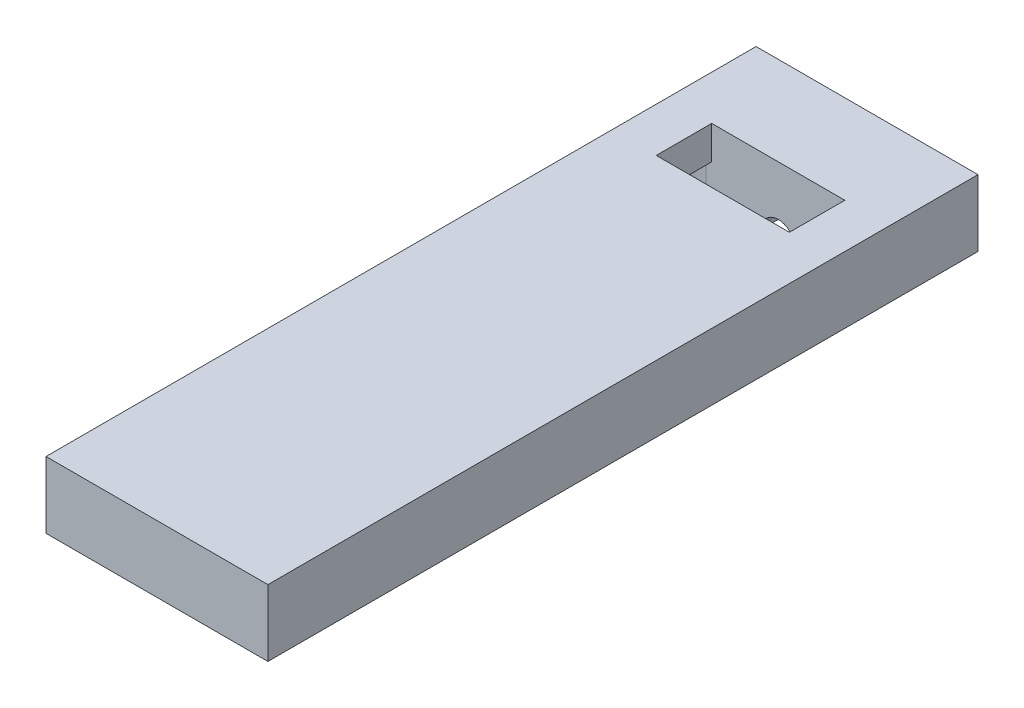
from build123d import *

# Parameters (mm, degrees)
SKETCH1_W           = 63.5
SKETCH1_H           = 203.2
BOSS_EXTRUDE1_DEPTH = 19.05
SKETCH2_R           = 4.7625
CUT_EXTRUDE1_DEPTH  = 25.4
CUT_EXTRUDE2_DEPTH  = 9.525
SKETCH5_W           = 38.1
SKETCH5_H           = 15.875
CUT_EXTRUDE4_DEPTH  = 109.136603424
SKETCH6_W           = 53.975
SKETCH6_H           = 36.83
CUT_EXTRUDE5_DEPTH  = 2.159


with BuildPart() as part:
    # Sketch1 → Boss-Extrude1 (new body)
    with BuildSketch(Plane(origin=(0, 0, 0), x_dir=(1, 0, 0), z_dir=(0, 1, 0))):
        Rectangle(SKETCH1_W, SKETCH1_H)
    extrude(amount=BOSS_EXTRUDE1_DEPTH)

    # Sketch2 → Cut-Extrude1 (cut)
    with BuildSketch(Plane(origin=(0, 0, -101.6), x_dir=(-1, 0, 0), z_dir=(0, 0, -1))):
        Circle(SKETCH2_R)
    extrude(amount=-CUT_EXTRUDE1_DEPTH, mode=Mode.SUBTRACT)

    # Sketch3 → Cut-Extrude2 (cut)
    with BuildSketch(Plane(origin=(0, 0, 0), x_dir=(-1, 0, 0), z_dir=(0, -1, 0))):
        with BuildLine():
            Line((-20.6375, -96.8375), (20.6375, -96.8375))
            ThreePointArc((20.6375, -96.8375), (25.127628061, -94.977628061), (26.9875, -90.4875))
            Line((26.9875, -90.4875), (26.9875, 1.27))
            ThreePointArc((26.9875, 1.27), (25.127628061, 5.760128061), (20.6375, 7.62))
            Line((20.6375, 7.62), (-20.6375, 7.62))
            ThreePointArc((-20.6375, 7.62), (-25.127628061, 5.760128061), (-26.9875, 1.27))
            Line((-26.9875, 1.27), (-26.9875, -90.4875))
            ThreePointArc((-26.9875, -90.4875), (-25.127628061, -94.977628061), (-20.6375, -96.8375))
        make_face()
        with BuildLine():
            Line((-20.6375, 76.2), (20.6375, 76.2))
            ThreePointArc((20.6375, 76.2), (25.127628061, 74.340128061), (26.9875, 69.85))
            Line((26.9875, 69.85), (26.9875, 38.1))
            ThreePointArc((26.9875, 38.1), (25.127628061, 33.609871939), (20.6375, 31.75))
            Line((20.6375, 31.75), (-20.6375, 31.75))
            ThreePointArc((-20.6375, 31.75), (-25.127628061, 33.609871939), (-26.9875, 38.1))
            Line((-26.9875, 38.1), (-26.9875, 69.85))
            ThreePointArc((-26.9875, 69.85), (-25.127628061, 74.340128061), (-20.6375, 76.2))
        make_face()
    extrude(amount=-CUT_EXTRUDE2_DEPTH, mode=Mode.SUBTRACT)

    # Sketch5 → Cut-Extrude4 (cut, through all)
    with BuildSketch(Plane(origin=(0, 0, 0), x_dir=(1, 0, 0), z_dir=(0, 1, 0))):
        with Locations((0, 68.2625)):
            Rectangle(SKETCH5_W, SKETCH5_H)
    extrude(amount=CUT_EXTRUDE4_DEPTH, mode=Mode.SUBTRACT)

    # Sketch6 → Cut-Extrude5 (cut)
    with BuildSketch(Plane(origin=(0, 0, 0), x_dir=(1, 0, 0), z_dir=(0, 1, 0))):
        with Locations((0, 19.685)):
            Rectangle(SKETCH6_W, SKETCH6_H)
    extrude(amount=CUT_EXTRUDE5_DEPTH, mode=Mode.SUBTRACT)


solid = part.part
